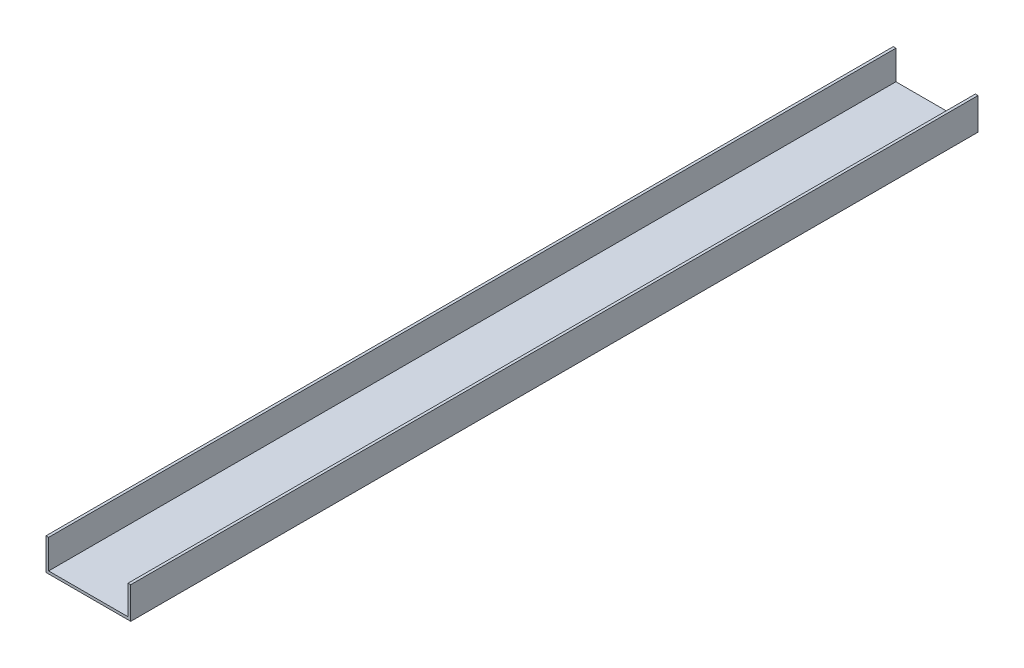
from build123d import *

# Parameters (mm, degrees)
BOSS_EXTRUDE2_DEPTH = 254


with BuildPart() as part:
    # Sketch3 → Boss-Extrude2 (new, symmetric)
    with BuildSketch(Plane.XY):
        Polygon((-25.4, 9.525), (-25.4, -9.525), (25.4, -9.525), (25.4, 9.525), (23.8125, 9.525), (23.8125, -7.9375), (-23.8125, -7.9375), (-23.8125, 9.525), align=None)
    extrude(amount=BOSS_EXTRUDE2_DEPTH, both=True)


solid = part.part
